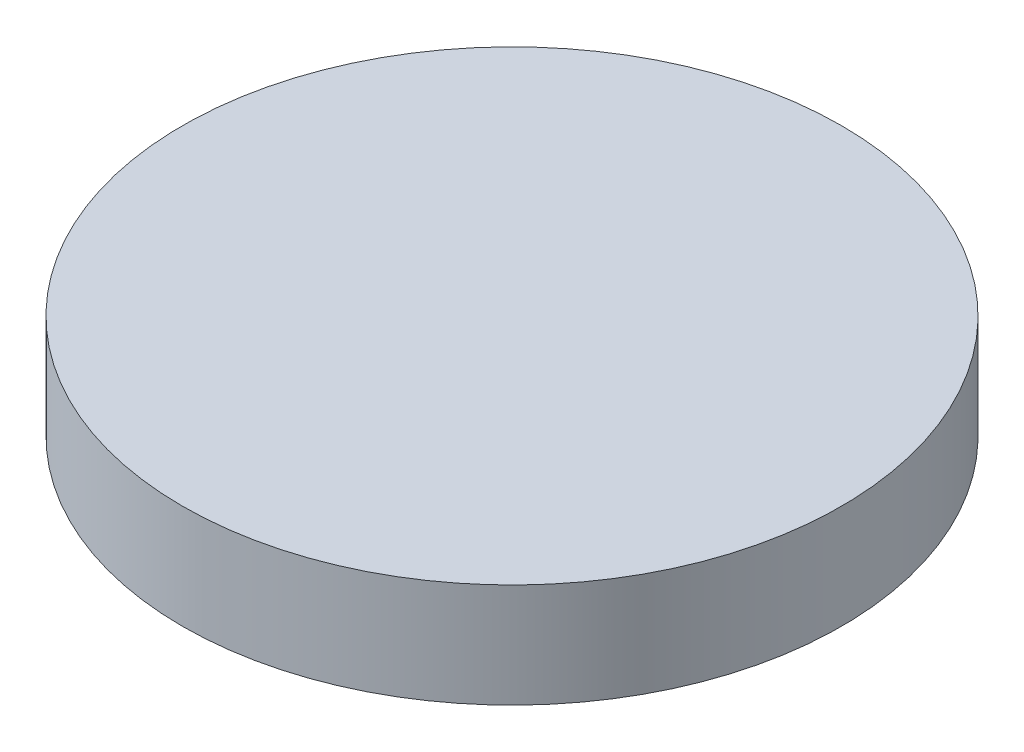
from build123d import *

# Parameters (mm, degrees)
SKETCH1_R           = 60.325
BOSS_EXTRUDE1_DEPTH = 19.05
SKETCH2_R           = 57.15
SKETCH2_R_2         = 55.5625
CUT_EXTRUDE1_DEPTH  = 3.175


with BuildPart() as part:
    # Sketch1 → Boss-Extrude1 (new body)
    with BuildSketch(Plane(origin=(0, 0, 0), x_dir=(1, 0, 0), z_dir=(0, 1, 0))):
        Circle(SKETCH1_R)
    extrude(amount=BOSS_EXTRUDE1_DEPTH)

    # Sketch2 → Cut-Extrude1 (cut)
    with BuildSketch(Plane.XZ):
        Circle(SKETCH2_R)
        Circle(SKETCH2_R_2, mode=Mode.SUBTRACT)
    extrude(amount=-CUT_EXTRUDE1_DEPTH, mode=Mode.SUBTRACT)


solid = part.part
